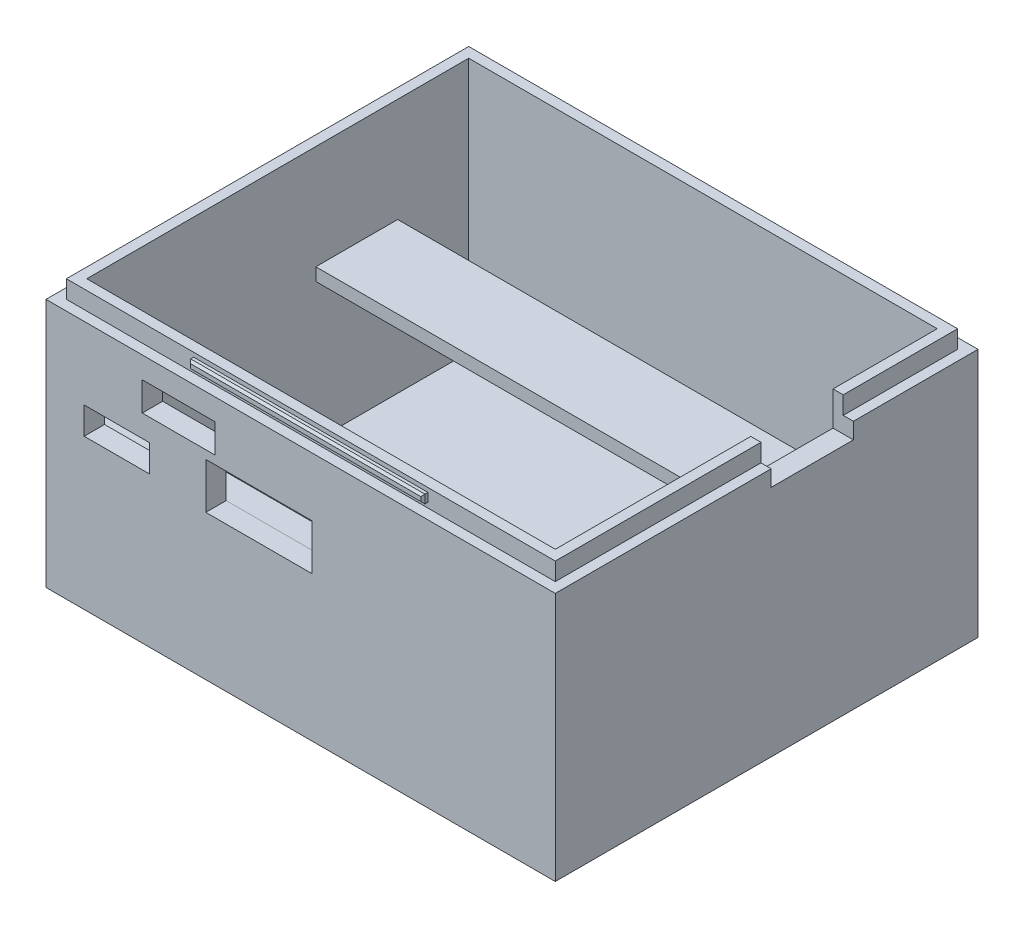
from build123d import *

# Parameters (mm, degrees)
BATTERYANDOUTERWALLS_W                  = 60
BATTERYANDOUTERWALLS_H                  = 49.8
BATTERYANDOUTERWALLS_W_2                = 55.2
BATTERYANDOUTERWALLS_H_2                = 45
WALLS_DEPTH                             = 30
SKETCH2_W                               = 60
SKETCH2_H                               = 49.8
BOTTOM_DEPTH                            = 1.5
SINKRIM_W                               = 60
SINKRIM_H                               = 49.8
SINKRIM_W_2                             = 57.6
SINKRIM_H_2                             = 47.4
TOP_CUT_DEPTH                           = 2.1
FRONTRAIL_W                             = 3
FRONTRAIL_H                             = 1.5
FRONTRAIL_W_2                           = 27.013247684
PCB_SUPPORTS_DEPTH                      = 60
SKETCH3_W                               = 55.2
SKETCH3_H                               = 8.369450911
SKETCH3_H_2                             = 9
BATTERY_INSERTION_CUT_DEPTH             = 25
USB_FRONT_W                             = 7.6828
USB_FRONT_H                             = 3.19
USB_FRONT_W_2                           = 12.5
USB_FRONT_H_2                           = 5.4
USB_FRONT_W_3                           = 8.570429098
USB_FRONT_H_3                           = 3.396429309
USB_FRONT_CUT_DEPTH                     = 10
USB_RIGHT_SKETCH_W                      = 9.69046632
USB_RIGHT_SKETCH_H                      = 4
CUT_EXTRUDE3_DEPTH                      = 5
SKETCH7_W                               = 27.6
SKETCH7_H                               = 1
LID_RIDGE_FRONT_DEPTH                   = 0.6
LID_RIDGE_FRONT_CHAMFER_SIZE            = 0.25
LID_RIDGE_FRONT_CHAMFER_OF_MIRROR1_SIZE = 0.25


with BuildPart() as part:
    # BatteryAndOuterWalls → Walls (new body)
    with BuildSketch(Plane(origin=(0, 0, 0), x_dir=(1, 0, 0), z_dir=(0, 1, 0))):
        Rectangle(BATTERYANDOUTERWALLS_W, BATTERYANDOUTERWALLS_H)
        Rectangle(BATTERYANDOUTERWALLS_W_2, BATTERYANDOUTERWALLS_H_2, mode=Mode.SUBTRACT)
    extrude(amount=WALLS_DEPTH)

    # Sketch2 → Bottom (add)
    with BuildSketch(Plane.XZ):
        Rectangle(SKETCH2_W, SKETCH2_H)
    extrude(amount=BOTTOM_DEPTH)

    # SinkRim → Top-Cut (cut)
    with BuildSketch(Plane(origin=(0, 30, 0), x_dir=(1, 0, 0), z_dir=(0, 1, 0))):
        Rectangle(SINKRIM_W, SINKRIM_H)
        Rectangle(SINKRIM_W_2, SINKRIM_H_2, mode=Mode.SUBTRACT)
    extrude(amount=-TOP_CUT_DEPTH, mode=Mode.SUBTRACT)

    # FrontRail → PCB-Supports (add)
    with BuildSketch(Plane(origin=(30, 0, 0), x_dir=(0, 0, -1), z_dir=(1, 0, 0))):
        with Locations((-21.013247684, 14.75)):
            Rectangle(FRONTRAIL_W, FRONTRAIL_H)
        with Locations((8.993376158, 16.980056232)):
            Rectangle(FRONTRAIL_W_2, FRONTRAIL_H)
    extrude(amount=-PCB_SUPPORTS_DEPTH)

    # Sketch3 → Battery-Insertion-Cut (cut)
    with BuildSketch(Plane(origin=(0, 0, 0), x_dir=(1, 0, 0), z_dir=(0, 1, 0))):
        with Locations((0, 18.315274544)):
            Rectangle(SKETCH3_W, SKETCH3_H)
        with Locations((0, -0.013247684)):
            Rectangle(SKETCH3_W, SKETCH3_H_2)
    extrude(amount=BATTERY_INSERTION_CUT_DEPTH, mode=Mode.SUBTRACT)

    # USB_FRONT → USB-Front-Cut (cut)
    with BuildSketch(Plane.XY.offset(24.9)):
        with Locations((-21.660729201, 17.775056232)):
            Rectangle(USB_FRONT_W, USB_FRONT_H)
        with Locations((-4.922329201, 18.280056232)):
            Rectangle(USB_FRONT_W_2, USB_FRONT_H_2)
        with Locations((-14.377122987, 23.666471982)):
            Rectangle(USB_FRONT_W_3, USB_FRONT_H_3)
    extrude(amount=-USB_FRONT_CUT_DEPTH, mode=Mode.SUBTRACT)

    # USB-Right-Sketch → Cut-Extrude3 (cut)
    with BuildSketch(Plane(origin=(30, 0, 0), x_dir=(0, 0, -1), z_dir=(1, 0, 0))):
        with Locations((5.375315929, 28)):
            Rectangle(USB_RIGHT_SKETCH_W, USB_RIGHT_SKETCH_H)
    extrude(amount=-CUT_EXTRUDE3_DEPTH, mode=Mode.SUBTRACT)

    # Sketch7 → Lid-Ridge-Front (add)
    with BuildSketch(Plane.XY.offset(23.7)):
        with Locations((0, 29)):
            Rectangle(SKETCH7_W, SKETCH7_H)
    lid_ridge_front = extrude(amount=LID_RIDGE_FRONT_DEPTH)

    # Lid-Ridge-Front-Chamfer
    lid_ridge_front_chamfer_edges = [part.edges().sort_by_distance(p)[0] for p in [
        (0, 29.5, 24.3),
        (13.8, 29, 24.3),
        (0, 28.5, 24.3),
        (-13.8, 29, 24.3),
    ]]
    chamfer(lid_ridge_front_chamfer_edges, length=LID_RIDGE_FRONT_CHAMFER_SIZE)

    # Mirror1: Lid-Ridge-Front across plane
    add(lid_ridge_front.mirror(Plane.XY))

    # Lid-Ridge-Front-Chamfer of Mirror1
    lid_ridge_front_chamfer_of_mirror1_edges = [part.edges().sort_by_distance(p)[0] for p in [
        (0, 29.5, -24.3),
        (13.8, 29, -24.3),
        (0, 28.5, -24.3),
        (-13.8, 29, -24.3),
    ]]
    chamfer(lid_ridge_front_chamfer_of_mirror1_edges, length=LID_RIDGE_FRONT_CHAMFER_OF_MIRROR1_SIZE)


solid = part.part
